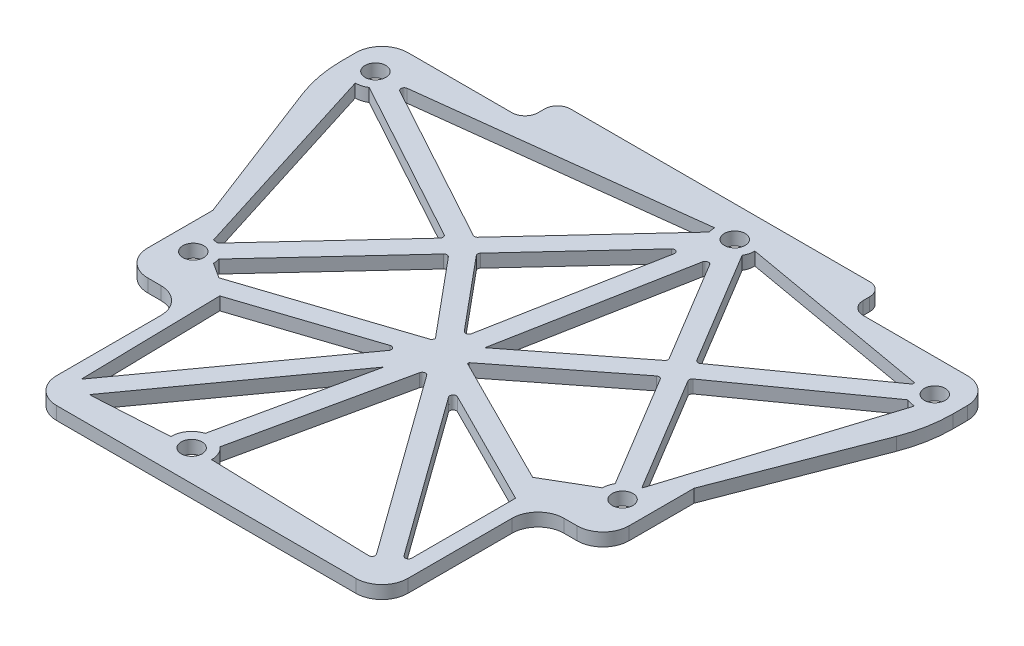
from build123d import *
from build123d.topology import SkipClean

# Parameters (mm, degrees)
SKETCH_1_W           = 94
SKETCH_1_H           = 74
EXTRUDE_1_DEPTH      = 2
CUT_EXTRUDE_1_REACH  = 61.85
SKETCH_2_R           = 1.6
CUT_EXTRUDE_2_REACH  = 61.85
CUT_EXTRUDE_3_REACH  = 61.85
SKETCH_4_W           = 10
SKETCH_4_H           = 24
FILLET_1_R           = 4
FILLET_2_R           = 4
CUT_EXTRUDE_4_REACH  = 61.85
SKETCH_5_R           = 1.6
SKETCH_7_W           = 50
SKETCH_7_H           = 10
EXTRUDE_2_DEPTH      = 2
FILLET_3_R           = 2
CUT_EXTRUDE_6_REACH  = 65.063
SKETCH_8_R           = 1.6
CUT_EXTRUDE_7_REACH  = 65.063
EXTRUDE_1_2_DEPTH    = 2
EXTRUDE_2_2_DEPTH    = 2
CUT_EXTRUDE_8_REACH  = 65.126
SKETCH_12_R          = 1.6
EXTRUDE_3_DEPTH      = 2
CUT_EXTRUDE_10_REACH = 65.126
EXTRUDE_START        = -2
EXTRUDE_4_DEPTH      = 2
EXTRUDE_3_2_DEPTH    = 2
CUT_EXTRUDE_11_REACH = 65.126
SKETCH_17_R          = 1.6
CUT_EXTRUDE_12_REACH = 65.126
SKETCH_18_R          = 1.6
CUT_EXTRUDE_START    = -2
CUT_EXTRUDE_13_DEPTH = 2
FILLET_4_R           = 0.5
FILLET_5_R           = 20.5


# Read off the part's stored shape, not the designer's step: 拉伸-薄壁4
with BuildPart() as part:
    # 草图1 → Extrude 1 (new body)
    with BuildSketch(Plane(origin=(0, 0, 0), x_dir=(1, 0, 0), z_dir=(0, 1, 0))):
        Rectangle(SKETCH_1_W, SKETCH_1_H)
    extrude(amount=EXTRUDE_1_DEPTH)

    # 草图2 → 切除-拉伸1 (cut, up to next)
    with BuildSketch(Plane(origin=(0, 2, 0), x_dir=(1, 0, 0), z_dir=(0, 1, 0)), mode=Mode.PRIVATE) as cut_extrude_1_sk1:
        with Locations(Location((-43, 32, 0), (0, 0, 270))):
            Circle(SKETCH_2_R)
    cut_extrude_1_tool1 = extrude(cut_extrude_1_sk1.sketch, amount=-CUT_EXTRUDE_1_REACH, mode=Mode.PRIVATE) & part.part
    # 草图2 → 切除-拉伸1 (cut, up to next)
    with BuildSketch(Plane(origin=(0, 2, 0), x_dir=(1, 0, 0), z_dir=(0, 1, 0)), mode=Mode.PRIVATE) as cut_extrude_1_sk2:
        with Locations(Location((43, 32, 0), (0, 0, 270))):
            Circle(SKETCH_2_R)
    cut_extrude_1_tool2 = extrude(cut_extrude_1_sk2.sketch, amount=-CUT_EXTRUDE_1_REACH, mode=Mode.PRIVATE) & part.part
    add(cut_extrude_1_tool1.solids().sort_by_distance((-43, 2, -32))[0], mode=Mode.SUBTRACT)
    add(cut_extrude_1_tool2.solids().sort_by_distance((43, 2, -32))[0], mode=Mode.SUBTRACT)

    # 草图3 → 切除-拉伸2 (cut, up to next)
    with BuildSketch(Plane(origin=(0, 2, 0), x_dir=(1, 0, 0), z_dir=(0, 1, 0)), mode=Mode.PRIVATE) as cut_extrude_2_sk1:
        Polygon((-47, 27), (-37, 1), (-37, -37), (-47, -37), align=None)
    cut_extrude_2_tool1 = extrude(cut_extrude_2_sk1.sketch, amount=-CUT_EXTRUDE_2_REACH, mode=Mode.PRIVATE) & part.part
    # 草图3 → 切除-拉伸2 (cut, up to next)
    with BuildSketch(Plane(origin=(0, 2, 0), x_dir=(1, 0, 0), z_dir=(0, 1, 0)), mode=Mode.PRIVATE) as cut_extrude_2_sk2:
        Polygon((37, -37), (47, -37), (47, 27), (37, 1), align=None)
    cut_extrude_2_tool2 = extrude(cut_extrude_2_sk2.sketch, amount=-CUT_EXTRUDE_2_REACH, mode=Mode.PRIVATE) & part.part
    add(cut_extrude_2_tool1.solids().sort_by_distance((-42.424837, 2, 10.947712))[0], mode=Mode.SUBTRACT)
    add(cut_extrude_2_tool2.solids().sort_by_distance((42.424837, 2, 10.947712))[0], mode=Mode.SUBTRACT)

    # 草图4 → 切除-拉伸3 (cut, up to next)
    with BuildSketch(Plane(origin=(0, 2, 0), x_dir=(1, 0, 0), z_dir=(0, 1, 0)), mode=Mode.PRIVATE) as cut_extrude_3_sk1:
        with Locations((-32, -25)):
            Rectangle(SKETCH_4_W, SKETCH_4_H)
    cut_extrude_3_tool1 = extrude(cut_extrude_3_sk1.sketch, amount=-CUT_EXTRUDE_3_REACH, mode=Mode.PRIVATE) & part.part
    # 草图4 → 切除-拉伸3 (cut, up to next)
    with BuildSketch(Plane(origin=(0, 2, 0), x_dir=(1, 0, 0), z_dir=(0, 1, 0)), mode=Mode.PRIVATE) as cut_extrude_3_sk2:
        with Locations((32, -25)):
            Rectangle(SKETCH_4_W, SKETCH_4_H)
    cut_extrude_3_tool2 = extrude(cut_extrude_3_sk2.sketch, amount=-CUT_EXTRUDE_3_REACH, mode=Mode.PRIVATE) & part.part
    add(cut_extrude_3_tool1.solids().sort_by_distance((-32, 2, 25))[0], mode=Mode.SUBTRACT)
    add(cut_extrude_3_tool2.solids().sort_by_distance((32, 2, 25))[0], mode=Mode.SUBTRACT)

    # 圆角1
    fillet_1_edges = [part.edges().sort_by_distance(p)[0] for p in [
        (-27, 1, 37),
        (27, 1, 37),
    ]]
    fillet(fillet_1_edges, radius=FILLET_1_R)

    # 圆角2
    fillet_2_edges = [part.edges().sort_by_distance(p)[0] for p in [
        (-37, 1, 13),
        (-27, 1, 13),
        (27, 1, 13),
        (37, 1, 13),
        (-47, 1, -37),
        (47, 1, -37),
    ]]
    fillet(fillet_2_edges, radius=FILLET_2_R)

    # 草图5 → 切除-拉伸4 (cut, up to next)
    with BuildSketch(Plane(origin=(0, 2, 0), x_dir=(1, 0, 0), z_dir=(0, 1, 0)), mode=Mode.PRIVATE) as cut_extrude_4_sk1:
        with Locations(Location((-33, -6, 0), (0, 0, 270))):
            Circle(SKETCH_5_R)
    cut_extrude_4_tool1 = extrude(cut_extrude_4_sk1.sketch, amount=-CUT_EXTRUDE_4_REACH, mode=Mode.PRIVATE) & part.part
    # 草图5 → 切除-拉伸4 (cut, up to next)
    with BuildSketch(Plane(origin=(0, 2, 0), x_dir=(1, 0, 0), z_dir=(0, 1, 0)), mode=Mode.PRIVATE) as cut_extrude_4_sk2:
        with Locations(Location((33, -6, 0), (0, 0, 270))):
            Circle(SKETCH_5_R)
    cut_extrude_4_tool2 = extrude(cut_extrude_4_sk2.sketch, amount=-CUT_EXTRUDE_4_REACH, mode=Mode.PRIVATE) & part.part
    add(cut_extrude_4_tool1.solids().sort_by_distance((-33, 2, 6))[0], mode=Mode.SUBTRACT)
    add(cut_extrude_4_tool2.solids().sort_by_distance((33, 2, 6))[0], mode=Mode.SUBTRACT)

    # 草图7 → Extrude 2 (add)
    with BuildSketch(Plane(origin=(0, 2, 0), x_dir=(1, 0, 0), z_dir=(0, 1, 0))):
        with Locations((0, 37)):
            Rectangle(SKETCH_7_W, SKETCH_7_H)
    extrude(amount=-EXTRUDE_2_DEPTH)

    # 圆角3
    fillet_3_edges = [part.edges().sort_by_distance(p)[0] for p in [
        (25, 1, -42),
        (25, 1, -37),
        (-25, 1, -37),
        (-25, 1, -42),
    ]]
    fillet(fillet_3_edges, radius=FILLET_3_R)

    # 草图8 → 切除-拉伸6 (cut, up to next)
    with BuildSketch(Plane(origin=(0, 2, 0), x_dir=(1, 0, 0), z_dir=(0, 1, 0)), mode=Mode.PRIVATE) as cut_extrude_6_sk1:
        with Locations(Location((7, 37.25, 0), (0, 0, 270))):
            Circle(SKETCH_8_R)
    cut_extrude_6_tool1 = extrude(cut_extrude_6_sk1.sketch, amount=-CUT_EXTRUDE_6_REACH, mode=Mode.PRIVATE) & part.part
    # 草图8 → 切除-拉伸6 (cut, up to next)
    with BuildSketch(Plane(origin=(0, 2, 0), x_dir=(1, 0, 0), z_dir=(0, 1, 0)), mode=Mode.PRIVATE) as cut_extrude_6_sk2:
        with Locations(Location((-7, -32.25, 0), (0, 0, 270))):
            Circle(SKETCH_8_R)
    cut_extrude_6_tool2 = extrude(cut_extrude_6_sk2.sketch, amount=-CUT_EXTRUDE_6_REACH, mode=Mode.PRIVATE) & part.part
    add(cut_extrude_6_tool1.solids().sort_by_distance((7, 2, -37.25))[0], mode=Mode.SUBTRACT)
    add(cut_extrude_6_tool2.solids().sort_by_distance((-7, 2, 32.25))[0], mode=Mode.SUBTRACT)

    # 草图9 → 切除-拉伸7 (cut, up to next)
    with BuildSketch(Plane.XZ, mode=Mode.PRIVATE) as cut_extrude_7_sk1:
        with BuildLine():
            Line((33, 2.9), (43, -28.9))
            ThreePointArc((43, -28.9), (40.807968978, -29.807968978), (39.9, -32))
            Line((39.9, -32), (10.1, -37.25))
            ThreePointArc((10.1, -37.25), (7, -34.15), (3.9, -37.25))
            Line((3.9, -37.25), (-39.9, -32))
            ThreePointArc((-39.9, -32), (-40.807968978, -29.807968978), (-43, -28.9))
            Line((-43, -28.9), (-33, 2.9))
            ThreePointArc((-33, 2.9), (-30.807968978, 3.807968978), (-29.9, 6))
            Line((-29.9, 6), (-3, 0))
            ThreePointArc((-3, 0), (0, -3), (3, 0))
            Line((3, 0), (29.9, 6))
            ThreePointArc((29.9, 6), (30.807968978, 3.807968978), (33, 2.9))
        make_face()
    cut_extrude_7_tool1 = extrude(cut_extrude_7_sk1.sketch, amount=-CUT_EXTRUDE_7_REACH, mode=Mode.PRIVATE) & part.part
    add(cut_extrude_7_tool1.solids().sort_by_distance((0.160682, 0, -16.717097))[0], mode=Mode.SUBTRACT)

    # 草图10 → Extrude 1 2 (add)
    with BuildSketch(Plane.XZ):
        Polygon((31.714416762, 6.772836166), (5.714416762, -36.477163834), (8.285583238, -38.022836166), (34.285583238, 5.227163834), align=None)
    extrude(amount=-EXTRUDE_1_2_DEPTH)

    # 草图11 → Extrude 2 2 (add)
    with BuildSketch(Plane.XZ):
        Polygon((-1.474196153, -0.277030149), (4.563536533, -32.406393368), (-31.898771517, 7.01847721), (-34.101228483, 4.98152279), (9.436463467, -42.093606632), (1.474196153, 0.277030149), align=None)
    extrude(amount=-EXTRUDE_2_2_DEPTH)

    # 草图12 → 切除-拉伸8 (cut, up to next)
    with BuildSketch(Plane.XZ, mode=Mode.PRIVATE) as cut_extrude_8_sk1:
        with Locations(Location((7, -37.25, 0), (0, 0, 90))):
            Circle(SKETCH_12_R)
    cut_extrude_8_tool1 = extrude(cut_extrude_8_sk1.sketch, amount=-CUT_EXTRUDE_8_REACH, mode=Mode.PRIVATE) & part.part
    # 草图12 → 切除-拉伸8 (cut, up to next)
    with BuildSketch(Plane.XZ, mode=Mode.PRIVATE) as cut_extrude_8_sk2:
        with Locations(Location((33, 6, 0), (0, 0, 90))):
            Circle(SKETCH_12_R)
    cut_extrude_8_tool2 = extrude(cut_extrude_8_sk2.sketch, amount=-CUT_EXTRUDE_8_REACH, mode=Mode.PRIVATE) & part.part
    # 草图12 → 切除-拉伸8 (cut, up to next)
    with BuildSketch(Plane.XZ, mode=Mode.PRIVATE) as cut_extrude_8_sk3:
        with Locations(Location((-33, 6, 0), (0, 0, 90))):
            Circle(SKETCH_12_R)
    cut_extrude_8_tool3 = extrude(cut_extrude_8_sk3.sketch, amount=-CUT_EXTRUDE_8_REACH, mode=Mode.PRIVATE) & part.part
    add(cut_extrude_8_tool1.solids().sort_by_distance((7, 0, -37.25))[0], mode=Mode.SUBTRACT)
    add(cut_extrude_8_tool2.solids().sort_by_distance((33, 0, 6))[0], mode=Mode.SUBTRACT)
    add(cut_extrude_8_tool3.solids().sort_by_distance((-33, 0, 6))[0], mode=Mode.SUBTRACT)

    # 草图13 → Extrude 3 (add)
    with BuildSketch(Plane.XZ):
        Polygon((-42.281337467, -33.316633648), (-12.030028979, -16.804461098), (0.222772907, -2.077535755), (19.102837119, -16.827585921), (42.130028358, -33.221944902), (43.869971642, -30.778055098), (20.897162881, -14.422414079), (-0.222772907, 2.077535755), (-13.969971021, -14.445538902), (-43.718662533, -30.683366352), align=None)
    extrude(amount=-EXTRUDE_3_DEPTH)

    # 草图14 → 切除-拉伸10 (cut, up to next)
    with BuildSketch(Plane.XZ, mode=Mode.PRIVATE) as cut_extrude_10_sk1:
        with BuildLine():
            Line((24.6, 9.1), (24.6, 33))
            Line((24.6, 33), (21.4, 33))
            Line((21.4, 33), (-3.900284118, 32.291969661))
            ThreePointArc((-3.900284118, 32.291969661), (-7.022929058, 29.150084798), (-10.098755887, 32.337817728))
            Line((-10.098755887, 32.337817728), (-21.4, 33))
            Line((-21.4, 33), (-24.6, 33))
            Line((-24.6, 33), (-25.089707761, 9.1))
            Line((-25.089707761, 9.1), (-29.9, 6))
            Line((-29.9, 6), (-3, 0))
            ThreePointArc((-3, 0), (0, 3), (3, 0))
            Line((3, 0), (29.9, 6))
            Line((29.9, 6), (24.6, 9.1))
        make_face()
    cut_extrude_10_tool1 = extrude(cut_extrude_10_sk1.sketch, amount=-CUT_EXTRUDE_10_REACH, mode=Mode.PRIVATE) & part.part
    add(cut_extrude_10_tool1.solids().sort_by_distance((-0.01036, 0, 17.191558))[0], mode=Mode.SUBTRACT)

    # 拉伸-薄壁4 outline → 拉伸-薄壁4 (add)
    with BuildSketch(Plane.XZ.offset(EXTRUDE_START)):
        with BuildLine():
            Line((-7.890413117, 29.280628942), (-2.992787477, 6.716567957))
            Line((-2.992787477, 6.716567957), (-21.940303837, 33))
            Line((-21.940303837, 33), (-24.6, 33))
            Line((-24.6, 33), (-24.628703352, 31.599143892))
            Line((-24.628703352, 31.599143892), (-3.921076206, 2.874138435))
            Line((-3.921076206, 2.874138435), (-25.074183755, 9.857643187))
            Line((-25.074183755, 9.857643187), (-25.089707761, 9.1))
            Line((-25.089707761, 9.1), (-27.548678233, 7.515312816))
            Line((-27.548678233, 7.515312816), (-2.937351268, -0.609891409))
            ThreePointArc((-2.937351268, -0.609891409), (-0.220609967, 2.991877545), (2.995038884, -0.172458936))
            Line((2.995038884, -0.172458936), (24.6, 10.695811795))
            Line((24.6, 10.695811795), (24.6, 14.054009188))
            Line((24.6, 14.054009188), (4.800407132, 4.093920184))
            Line((4.800407132, 4.093920184), (24.6, 31.559327455))
            Line((24.6, 31.559327455), (24.6, 33))
            Line((24.6, 33), (21.940303837, 33))
            Line((21.940303837, 33), (0.751807476, 3.607947046))
            Line((0.751807476, 3.607947046), (-4.958679063, 29.916974318))
            ThreePointArc((-4.958679063, 29.916974318), (-6.342443111, 29.220541478), (-7.890413117, 29.280628942))
        make_face()
        with BuildLine():
            ThreePointArc((-24.78947967, 36.577396052), (-24.688976568, 36.625928592), (-24.587158568, 36.671638283))
            Line((-24.587158568, 36.671638283), (-24.611640499, 36.705598891))
            Line((-24.611640499, 36.705598891), (-24.78947967, 36.577396052))
        make_face()
        with BuildLine():
            ThreePointArc((-26.71233249, 34.489492359), (-26.338198715, 35.203730778), (-25.828427125, 35.828427125))
            Line((-25.828427125, 35.828427125), (-27.045213751, 34.951255359))
            Line((-27.045213751, 34.951255359), (-26.71233249, 34.489492359))
        make_face()
        with BuildLine():
            ThreePointArc((-35.828427125, 11.828427125), (-35.035060609, 12.443621396), (-34.113498704, 12.841890243))
            Line((-34.113498704, 12.841890243), (-35.358180035, 13.252810386))
            Line((-35.358180035, 13.252810386), (-35.828427125, 11.828427125))
        make_face()
        with BuildLine():
            ThreePointArc((25.828427125, 35.828427125), (26.338198715, 35.203730778), (26.71233249, 34.489492359))
            Line((26.71233249, 34.489492359), (27.045213751, 34.951255359))
            Line((27.045213751, 34.951255359), (25.828427125, 35.828427125))
        make_face()
        with BuildLine():
            ThreePointArc((24.587158568, 36.671638283), (24.688976568, 36.625928592), (24.78947967, 36.577396052))
            Line((24.78947967, 36.577396052), (24.611640499, 36.705598891))
            Line((24.611640499, 36.705598891), (24.587158568, 36.671638283))
        make_face()
        with BuildLine():
            Line((28.171572875, 14.171572875), (27.497490064, 15.511577489))
            Line((27.497490064, 15.511577489), (27.323529351, 15.424067397))
            ThreePointArc((27.323529351, 15.424067397), (27.687808974, 14.757369712), (28.171572875, 14.171572875))
        make_face()
        with BuildLine():
            ThreePointArc((-8.347766323, 31.387720499), (-6.660615799, 30.686408505), (-5.41603227, 32.024065875))
            Line((-5.41603227, 32.024065875), (-5.534132973, 32.568172688))
            Line((-5.534132973, 32.568172688), (-8.465867027, 31.931827312))
            Line((-8.465867027, 31.931827312), (-8.347766323, 31.387720499))
        make_face()
    extrude(amount=EXTRUDE_4_DEPTH)

    # 草图16 → Extrude 3 2 (add)
    with BuildSketch(Plane(origin=(0, 2, 0), x_dir=(1, 0, 0), z_dir=(0, 1, 0))):
        Polygon((24.6, -9.1), (24.6, -10.695811795), (23.133194892, -9.957942611), align=None)
    extrude(amount=-EXTRUDE_3_2_DEPTH)

    # 草图17 → 切除-拉伸11 (cut, up to next)
    with BuildSketch(Plane(origin=(0, 2, 0), x_dir=(1, 0, 0), z_dir=(0, 1, 0)), mode=Mode.PRIVATE) as cut_extrude_11_sk1:
        with Locations(Location((-43, 32, 0), (0, 0, 270))):
            Circle(SKETCH_17_R)
    cut_extrude_11_tool1 = extrude(cut_extrude_11_sk1.sketch, amount=-CUT_EXTRUDE_11_REACH, mode=Mode.PRIVATE) & part.part
    # 草图17 → 切除-拉伸11 (cut, up to next)
    with BuildSketch(Plane(origin=(0, 2, 0), x_dir=(1, 0, 0), z_dir=(0, 1, 0)), mode=Mode.PRIVATE) as cut_extrude_11_sk2:
        with Locations(Location((43, 32, 0), (0, 0, 270))):
            Circle(SKETCH_17_R)
    cut_extrude_11_tool2 = extrude(cut_extrude_11_sk2.sketch, amount=-CUT_EXTRUDE_11_REACH, mode=Mode.PRIVATE) & part.part
    add(cut_extrude_11_tool1.solids().sort_by_distance((-43, 2, -32))[0], mode=Mode.SUBTRACT)
    add(cut_extrude_11_tool2.solids().sort_by_distance((43, 2, -32))[0], mode=Mode.SUBTRACT)

    # 草图18 → 切除-拉伸12 (cut, up to next)
    with BuildSketch(Plane(origin=(0, 2, 0), x_dir=(1, 0, 0), z_dir=(0, 1, 0)), mode=Mode.PRIVATE) as cut_extrude_12_sk1:
        with Locations(Location((-7, -32.25, 0), (0, 0, 270))):
            Circle(SKETCH_18_R)
    cut_extrude_12_tool1 = extrude(cut_extrude_12_sk1.sketch, amount=-CUT_EXTRUDE_12_REACH, mode=Mode.PRIVATE) & part.part
    add(cut_extrude_12_tool1.solids().sort_by_distance((-7, 2, 32.25))[0], mode=Mode.SUBTRACT)

    # 草图19 → 切除-拉伸13 (cut)
    with SkipClean():  # the faces are left unmerged after this step: merging them gives an invalid solid
        with BuildSketch(Plane(origin=(0, 2, 0), x_dir=(1, 0, 0), z_dir=(0, 1, 0)).offset(CUT_EXTRUDE_START)):
            Polygon((9.436463467, 42.093606632), (9.34989086, 42), (9.418872959, 42), align=None)
            with BuildLine():
                Line((-37, -9), (-37, -14.575213497))
                Line((-37, -14.575213497), (-33, -13))
                ThreePointArc((-33, -13), (-35.828427125, -11.828427125), (-37, -9))
            make_face()
            with BuildLine():
                Line((-27, -33), (-27.735971998, -37))
                Line((-27.735971998, -37), (-23, -37))
                ThreePointArc((-23, -37), (-25.828427125, -35.828427125), (-27, -33))
            make_face()
            with BuildLine():
                Line((23, -37), (27.995595448, -37))
                Line((27.995595448, -37), (27, -33))
                ThreePointArc((27, -33), (25.828427125, -35.828427125), (23, -37))
            make_face()
            with BuildLine():
                Line((27, -17), (31, -17))
                Line((31, -17), (31, -13))
                ThreePointArc((31, -13), (28.171572875, -14.171572875), (27, -17))
            make_face()
        extrude(amount=CUT_EXTRUDE_13_DEPTH, mode=Mode.SUBTRACT)

    # 圆角4
    fillet_4_edges = [part.edges().sort_by_distance(p)[0] for p in [
        (4.563536533, 1, -32.406393368),
        (7.745968105, 1, -33.097756312),
        (-39.874732803, 1, -32.003028602),
        (21.940303837, 1, 33),
        (24.6, 1, 31.559327455),
        (19.587738677, 1, -13.399426419),
        (18.030504302, 1, -15.989825908),
        (20.450458624, 1, -17.787033841),
        (22.00077679, 1, -15.208139199),
        (4.800407132, 1, 4.093920184),
        (0.751807476, 1, 3.607947046),
        (-3.921076206, 1, 2.874138435),
        (-0.885521483, 1, -3.409620358),
        (-13.059614905, 1, -13.351360877),
        (-11.005200654, 1, -15.572696285),
        (-13.307468513, 1, -17.501730178),
        (-15.408041458, 1, -15.230485682),
    ]]
    fillet(fillet_4_edges, radius=FILLET_4_R)

    # 圆角5
    fillet_5_edges = [part.edges().sort_by_distance(p)[0] for p in [
        (-47, 1, -27),
        (47, 1, -27),
    ]]
    fillet(fillet_5_edges, radius=FILLET_5_R)


solid = part.part
